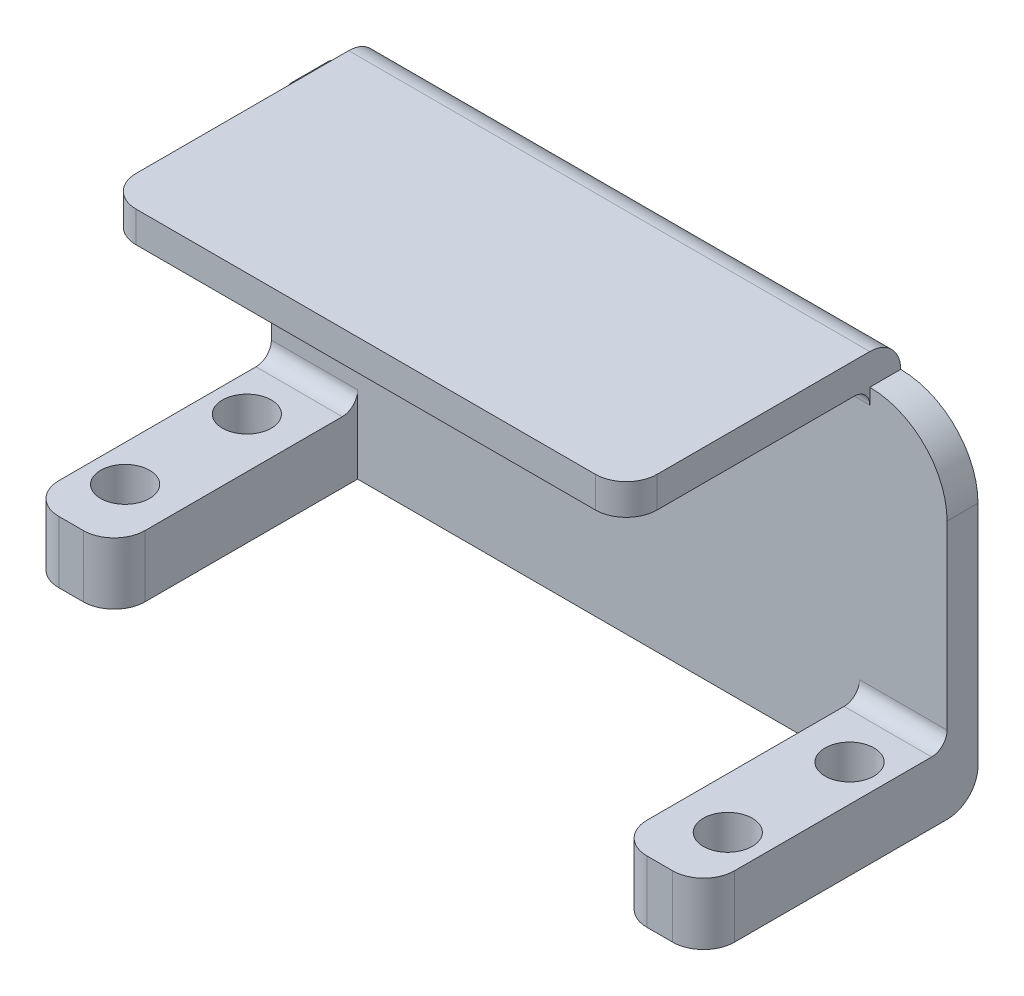
from build123d import *

# Parameters (mm, degrees)
SKETCH2_W                      = 42.8
SKETCH2_H                      = 2.54
BOSS_EXTRUDE1_DEPTH            = 2.54
SKETCH7_W                      = 7.192
SKETCH7_H                      = 5.08
SKETCH7_W_2                    = 42.8
SKETCH7_H_2                    = 2.54
BOSS_EXTRUDE3_DEPTH            = 20
FILLET3_R                      = 2.54
FILLET4_R                      = 1.27
CUT_EXTRUDE2_REACH             = 49.098
SKETCH8_R                      = 2.01
CUT_EXTRUDE2_DIRECTION_2_REACH = 49.098


# Some blends are built 0.0001 mm under size
with BuildPart() as part:
    # Sketch2 → Boss-Extrude1 (new body)
    with BuildSketch(Plane.XY):
        with Locations((-2.467346939, 15.826258503)):
            Rectangle(SKETCH2_W, SKETCH2_H)
        with BuildLine():
            Line((18.932653061, 14.556258503), (-23.867346939, 14.556258503))
            ThreePointArc((-23.867346939, 14.556258503), (-28.357474999, 12.696386564), (-30.217346939, 8.206258503))
            Line((-30.217346939, 8.206258503), (-30.217346939, -13.013741497))
            Line((-30.217346939, -13.013741497), (25.282653061, -13.013741497))
            Line((25.282653061, -13.013741497), (25.282653061, 8.206258503))
            ThreePointArc((25.282653061, 8.206258503), (23.422781122, 12.696386564), (18.932653061, 14.556258503))
        make_face()
    extrude(amount=-BOSS_EXTRUDE1_DEPTH)

    # Sketch7 → Boss-Extrude3 (add)
    with BuildSketch(Plane.XY):
        Polygon((-30.217346939, -7.933741497), (-30.217346939, -13.013741497), (-23.125346939, -13.003741497), (-23.125346939, -7.933741497), align=None)
        with Locations((21.686653061, -10.473741497)):
            Rectangle(SKETCH7_W, SKETCH7_H)
        with Locations((-2.467346939, 15.826258503)):
            Rectangle(SKETCH7_W_2, SKETCH7_H_2)
    extrude(amount=BOSS_EXTRUDE3_DEPTH)

    # Fillet3
    fillet3_edges = [part.edges().sort_by_distance(p)[0] for p in [
        (-2.467346939, 17.096258503, -2.54),
        (18.932653061, 15.826258503, 20),
        (-23.867346939, 15.826258503, 20),
        (-2.467346939, -13.013741497, -2.54),
        (18.090653061, -10.473741497, 20),
        (25.282653061, -10.473741497, 20),
        (-23.125346939, -10.468741497, 20),
        (-30.217346939, -10.473741497, 20),
    ]]
    fillet(fillet3_edges, radius=FILLET3_R - 0.0001)  # a hair under: the kernel refuses the full size

    # Fillet4
    # the kernel refuses this fillet: 1.27 mm, written as the material it adds along each edge
    with BuildSketch(Plane(origin=(-23.125346939, -7.933741497, 0), x_dir=(0, 1, 0), z_dir=(-1, 0, 0))) as fillet4_piece_1:
        with BuildLine():
            CenterArc((FILLET4_R, -FILLET4_R), FILLET4_R, 90, 90)
            Line((0, -FILLET4_R), (0, 0))
            Line((0, 0), (FILLET4_R, 0))
        make_face()
    extrude(amount=7.092)
    with BuildSketch(Plane(origin=(25.282653061, -7.933741497, 0), x_dir=(0, 1, 0), z_dir=(-1, 0, 0))) as fillet4_piece_2:
        with BuildLine():
            CenterArc((FILLET4_R, -FILLET4_R), FILLET4_R, 90, 90)
            Line((0, -FILLET4_R), (0, 0))
            Line((0, 0), (FILLET4_R, 0))
        make_face()
    extrude(amount=7.192)
    with BuildSketch(Plane(origin=(-23.867346939, 14.556258503, 0), x_dir=(0, 0, 1), z_dir=(1, 0, 0))) as fillet4_piece_3:
        with BuildLine():
            CenterArc((FILLET4_R, FILLET4_R), FILLET4_R, 180, 90)
            Line((0, FILLET4_R), (0, 0))
            Line((0, 0), (FILLET4_R, 0))
        make_face()
    extrude(amount=42.8)

    # Cut-Extrude2: up to this face of the body (flat: up to its plane)
    cut_extrude2_end = Plane(part.part.faces().sort_by_distance((-26.671346939, -7.933741497, 10.447713694))[0])
    # Sketch8 → Cut-Extrude2 (cut, up to the picked face)
    with BuildSketch(Plane(origin=(0.018289774, -12.971108055, 0), x_dir=(0.9999990058958133, 0.0014100380793790163, 0), z_dir=(0.0014100380793790163, -0.9999990058958133, 0)), mode=Mode.PRIVATE) as cut_extrude2_sk1:
        with Locations((-27.239885767, 5)):
            Circle(SKETCH8_R)
    cut_extrude2_tool1 = split(extrude(cut_extrude2_sk1.sketch, amount=-CUT_EXTRUDE2_REACH, mode=Mode.PRIVATE), bisect_by=cut_extrude2_end, keep=Keep.BOTH, mode=Mode.PRIVATE)
    # Sketch8 → Cut-Extrude2 (cut, up to the picked face)
    with BuildSketch(Plane(origin=(0.018289774, -12.971108055, 0), x_dir=(0.9999990058958133, 0.0014100380793790163, 0), z_dir=(0.0014100380793790163, -0.9999990058958133, 0)), mode=Mode.PRIVATE) as cut_extrude2_sk2:
        with Locations((22.260065025, 5)):
            Circle(SKETCH8_R)
    cut_extrude2_tool2 = split(extrude(cut_extrude2_sk2.sketch, amount=-CUT_EXTRUDE2_REACH, mode=Mode.PRIVATE), bisect_by=cut_extrude2_end, keep=Keep.BOTH, mode=Mode.PRIVATE)
    # Sketch8 → Cut-Extrude2 (cut, up to the picked face)
    with BuildSketch(Plane(origin=(0.018289774, -12.971108055, 0), x_dir=(0.9999990058958133, 0.0014100380793790163, 0), z_dir=(0.0014100380793790163, -0.9999990058958133, 0)), mode=Mode.PRIVATE) as cut_extrude2_sk3:
        with Locations((22.260065025, 15)):
            Circle(SKETCH8_R)
    cut_extrude2_tool3 = split(extrude(cut_extrude2_sk3.sketch, amount=-CUT_EXTRUDE2_REACH, mode=Mode.PRIVATE), bisect_by=cut_extrude2_end, keep=Keep.BOTH, mode=Mode.PRIVATE)
    # Sketch8 → Cut-Extrude2 (cut, up to the picked face)
    with BuildSketch(Plane(origin=(0.018289774, -12.971108055, 0), x_dir=(0.9999990058958133, 0.0014100380793790163, 0), z_dir=(0.0014100380793790163, -0.9999990058958133, 0)), mode=Mode.PRIVATE) as cut_extrude2_sk4:
        with Locations((-27.239885767, 15)):
            Circle(SKETCH8_R)
    cut_extrude2_tool4 = split(extrude(cut_extrude2_sk4.sketch, amount=-CUT_EXTRUDE2_REACH, mode=Mode.PRIVATE), bisect_by=cut_extrude2_end, keep=Keep.BOTH, mode=Mode.PRIVATE)
    add(cut_extrude2_tool1.solids().sort_by(Axis((-27.221569, -13.009517, 5), (-0.0014100380793790163, 0.9999990058958133, 0)))[0], mode=Mode.SUBTRACT)
    add(cut_extrude2_tool2.solids().sort_by(Axis((22.278333, -12.939721, 5), (-0.0014100380793790163, 0.9999990058958133, 0)))[0], mode=Mode.SUBTRACT)
    add(cut_extrude2_tool3.solids().sort_by(Axis((22.278333, -12.939721, 15), (-0.0014100380793790163, 0.9999990058958133, 0)))[0], mode=Mode.SUBTRACT)
    add(cut_extrude2_tool4.solids().sort_by(Axis((-27.221569, -13.009517, 15), (-0.0014100380793790163, 0.9999990058958133, 0)))[0], mode=Mode.SUBTRACT)

    # Cut-Extrude2 direction 2: up to this face of the body (flat: up to its plane)
    cut_extrude2_direction_2_end = Plane(part.part.faces().sort_by_distance((21.685702836, -13.013741497, 9.814476997))[0])
    # Sketch8 → Cut-Extrude2 direction 2 (cut, up to the picked face)
    with BuildSketch(Plane(origin=(0.018289774, -12.971108055, 0), x_dir=(0.9999990058958133, 0.0014100380793790163, 0), z_dir=(0.0014100380793790163, -0.9999990058958133, 0)), mode=Mode.PRIVATE) as cut_extrude2_direction_2_sk1:
        with Locations((-27.239885767, 5)):
            Circle(SKETCH8_R)
    cut_extrude2_direction_2_tool1 = split(extrude(cut_extrude2_direction_2_sk1.sketch, amount=CUT_EXTRUDE2_DIRECTION_2_REACH, mode=Mode.PRIVATE), bisect_by=cut_extrude2_direction_2_end, keep=Keep.BOTH, mode=Mode.PRIVATE)
    # Sketch8 → Cut-Extrude2 direction 2 (cut, up to the picked face)
    with BuildSketch(Plane(origin=(0.018289774, -12.971108055, 0), x_dir=(0.9999990058958133, 0.0014100380793790163, 0), z_dir=(0.0014100380793790163, -0.9999990058958133, 0)), mode=Mode.PRIVATE) as cut_extrude2_direction_2_sk2:
        with Locations((22.260065025, 5)):
            Circle(SKETCH8_R)
    cut_extrude2_direction_2_tool2 = split(extrude(cut_extrude2_direction_2_sk2.sketch, amount=CUT_EXTRUDE2_DIRECTION_2_REACH, mode=Mode.PRIVATE), bisect_by=cut_extrude2_direction_2_end, keep=Keep.BOTH, mode=Mode.PRIVATE)
    # Sketch8 → Cut-Extrude2 direction 2 (cut, up to the picked face)
    with BuildSketch(Plane(origin=(0.018289774, -12.971108055, 0), x_dir=(0.9999990058958133, 0.0014100380793790163, 0), z_dir=(0.0014100380793790163, -0.9999990058958133, 0)), mode=Mode.PRIVATE) as cut_extrude2_direction_2_sk3:
        with Locations((22.260065025, 15)):
            Circle(SKETCH8_R)
    cut_extrude2_direction_2_tool3 = split(extrude(cut_extrude2_direction_2_sk3.sketch, amount=CUT_EXTRUDE2_DIRECTION_2_REACH, mode=Mode.PRIVATE), bisect_by=cut_extrude2_direction_2_end, keep=Keep.BOTH, mode=Mode.PRIVATE)
    # Sketch8 → Cut-Extrude2 direction 2 (cut, up to the picked face)
    with BuildSketch(Plane(origin=(0.018289774, -12.971108055, 0), x_dir=(0.9999990058958133, 0.0014100380793790163, 0), z_dir=(0.0014100380793790163, -0.9999990058958133, 0)), mode=Mode.PRIVATE) as cut_extrude2_direction_2_sk4:
        with Locations((-27.239885767, 15)):
            Circle(SKETCH8_R)
    cut_extrude2_direction_2_tool4 = split(extrude(cut_extrude2_direction_2_sk4.sketch, amount=CUT_EXTRUDE2_DIRECTION_2_REACH, mode=Mode.PRIVATE), bisect_by=cut_extrude2_direction_2_end, keep=Keep.BOTH, mode=Mode.PRIVATE)
    add(cut_extrude2_direction_2_tool1.solids().sort_by(Axis((-27.221569, -13.009517, 5), (0.0014100380793790163, -0.9999990058958133, 0)))[0], mode=Mode.SUBTRACT)
    add(cut_extrude2_direction_2_tool2.solids().sort_by(Axis((22.278333, -12.939721, 5), (0.0014100380793790163, -0.9999990058958133, 0)))[0], mode=Mode.SUBTRACT)
    add(cut_extrude2_direction_2_tool3.solids().sort_by(Axis((22.278333, -12.939721, 15), (0.0014100380793790163, -0.9999990058958133, 0)))[0], mode=Mode.SUBTRACT)
    add(cut_extrude2_direction_2_tool4.solids().sort_by(Axis((-27.221569, -13.009517, 15), (0.0014100380793790163, -0.9999990058958133, 0)))[0], mode=Mode.SUBTRACT)


solid = part.part
